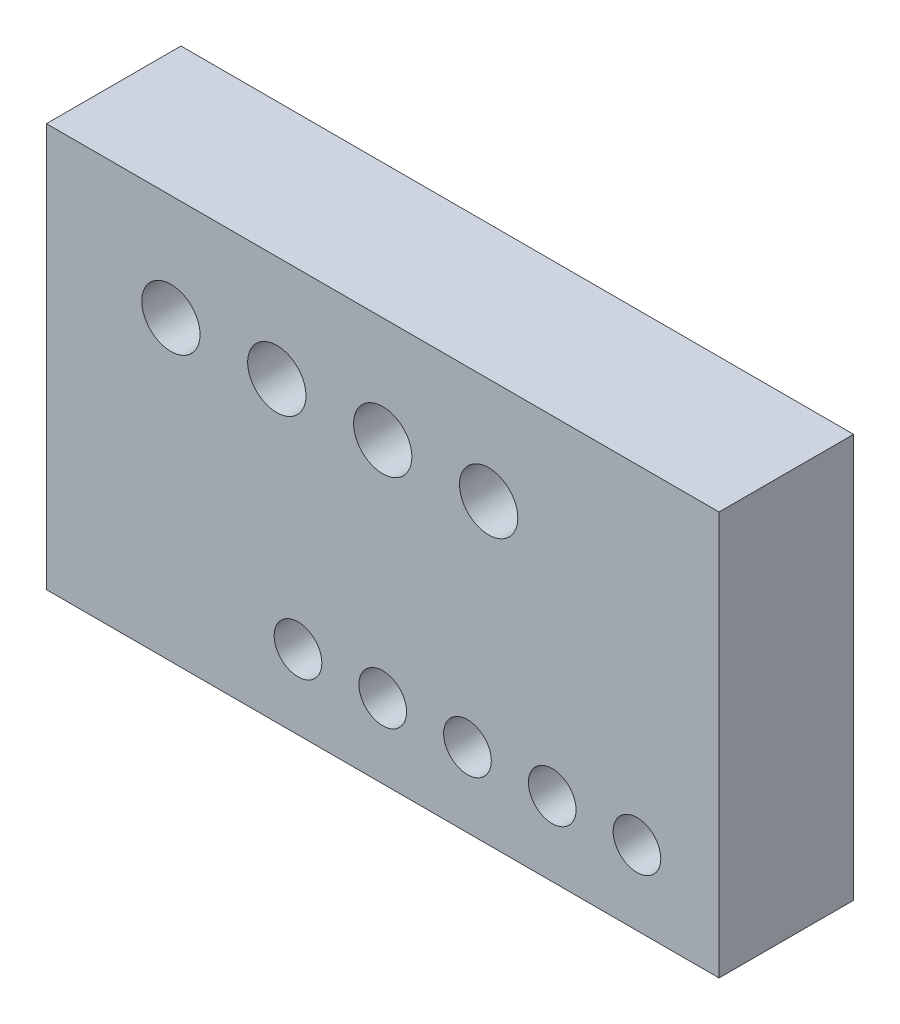
from build123d import *

# Parameters (mm, degrees)
SKETCH1_W            = 63.5
SKETCH1_H            = 38.1
BOSS_EXTRUDE1_DEPTH  = 12.7
M4_CLEARANCE_HOLE1_D = 4.5
M5_CLEARANCE_HOLE1_D = 5.5


with BuildPart() as part:
    # Sketch1 → Boss-Extrude1 (new body)
    with BuildSketch(Plane.XY):
        Rectangle(SKETCH1_W, SKETCH1_H)
    extrude(amount=BOSS_EXTRUDE1_DEPTH)

    # M4 Clearance Hole1 (through all)
    with Locations(Plane.XY.offset(12.7)):
        with Locations((-8, -12.05), (0, -12.05), (8, -12.05), (16, -12.05), (24, -12.05)):
            Hole(M4_CLEARANCE_HOLE1_D / 2)

    # M5 Clearance Hole1 (through all)
    with Locations(Plane.XY.offset(12.7)):
        with Locations((-20, 9.05), (-10, 9.05), (0, 9.05), (10, 9.05)):
            Hole(M5_CLEARANCE_HOLE1_D / 2)


solid = part.part
